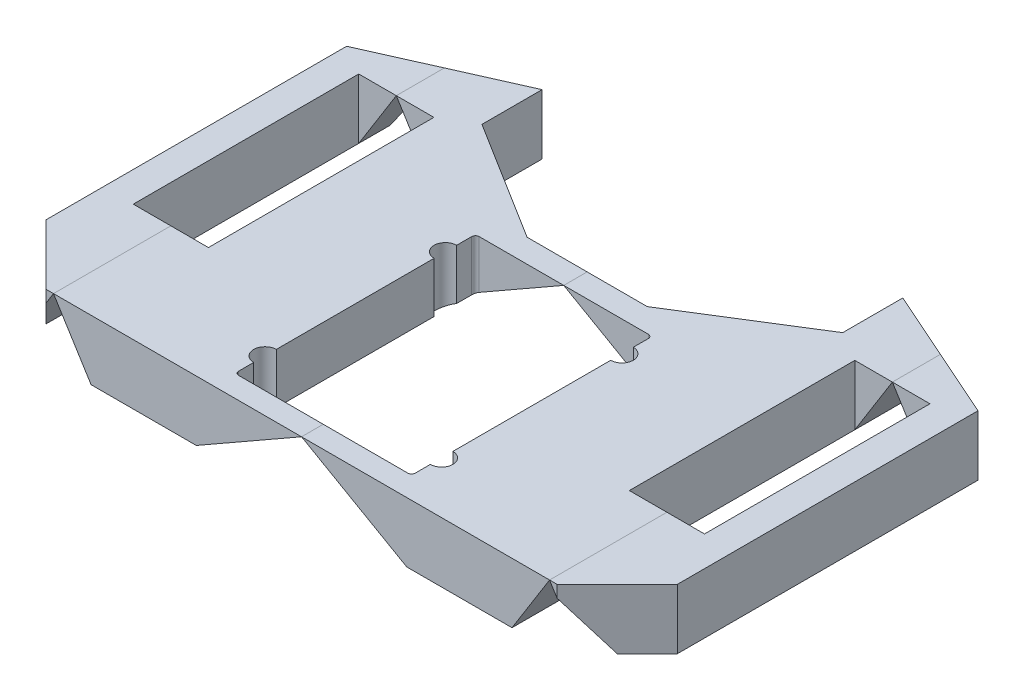
from build123d import *

# Parameters (mm, degrees)
SKETCH1_W           = 63.5
SKETCH1_H           = 190.5
BOSS_EXTRUDE1_DEPTH = 50.8
CUT_EXTRUDE1_DEPTH  = 708.805574494
CUT_EXTRUDE2_DEPTH  = 708.805574494


with BuildPart() as part:
    # Sketch1 → Boss-Extrude1 (new body)
    with BuildSketch(Plane(origin=(0, 0, 0), x_dir=(1, 0, 0), z_dir=(0, 1, 0))):
        Polygon((446.699903074, -123.787447361), (345.099903074, -187.287447361), (243.499903074, -187.287447361), (141.899903074, -123.787447361), (141.899903074, -72.987447361), (27.599903074, -123.787447361), (27.599903074, -123.848308515), (27.599903074, -375.907017994), (27.599903074, -377.787447361), (78.399903074, -428.587447361), (510.199903074, -428.587447361), (560.999903074, -377.787447361), (560.999903074, -123.787447361), (446.699903074, -72.987447361), align=None)
        with Locations((84.749903074, -234.21600548)):
            Rectangle(SKETCH1_W, SKETCH1_H, mode=Mode.SUBTRACT)
        with Locations((503.849903074, -234.21600548)):
            Rectangle(SKETCH1_W, SKETCH1_H, mode=Mode.SUBTRACT)
    extrude(amount=-BOSS_EXTRUDE1_DEPTH)

    # Sketch2 → Cut-Extrude1 (cut, through all)
    with BuildSketch(Plane.XY):
        Polygon((52.999903074, -50.8), (84.749903074, 0), (116.499903074, -50.8), align=None)
        Polygon((294.299903074, 0), (205.399903074, -50.8), (383.199903074, -50.8), align=None)
        Polygon((472.099903074, -50.8), (535.599903074, -50.8), (503.849903074, 0), align=None)
    extrude(amount=CUT_EXTRUDE1_DEPTH, mode=Mode.SUBTRACT)


with BuildPart() as cut_extrude1_piece_1:
    # of the separate pieces the step leaves, piece 1, a body of its own (cut_extrude1_pieces)
    add(part.part.solids().sort_by_distance((116.499903074, 0, 329.46600548))[0])


with BuildPart() as cut_extrude1_piece_2:
    # of the separate pieces the step leaves, piece 2, a body of its own (cut_extrude1_pieces)
    add(part.part.solids().sort_by_distance((446.699903074, 0, 123.787447361))[0])


with BuildPart() as cut_extrude1_piece_3:
    # of the separate pieces the step leaves, piece 3, a body of its own (cut_extrude1_pieces)
    add(part.part.solids().sort_by_distance((560.999903074, 0, 123.787447361))[0])


with BuildPart() as cut_extrude1_piece_4:
    # of the separate pieces the step leaves, piece 4, a body of its own (cut_extrude1_pieces)
    add(part.part.solids().sort_by_distance((78.399903074, 0, 428.587447361))[0])


with BuildPart() as cut_extrude2_tool:
    # Sketch4 → Cut-Extrude2 (new, through all)
    with BuildSketch(Plane(origin=(0, 0, 0), x_dir=(1, 0, 0), z_dir=(0, 1, 0))):
        with BuildLine():
            Line((368.912403074, -222.939372853), (368.912403074, -210.239372853))
            ThreePointArc((368.912403074, -210.239372853), (367.982467104, -207.994308822), (365.737403074, -207.064372853))
            Line((365.737403074, -207.064372853), (222.862403074, -207.064372853))
            ThreePointArc((222.862403074, -207.064372853), (220.617339043, -207.994308822), (219.687403074, -210.239372853))
            Line((219.687403074, -210.239372853), (219.687403074, -222.939372853))
            ThreePointArc((219.687403074, -222.939372853), (210.162403074, -232.464372853), (219.687403074, -241.989372853))
            Line((219.687403074, -241.989372853), (219.687403074, -375.339372853))
            ThreePointArc((219.687403074, -375.339372853), (210.162403074, -384.864372853), (219.687403074, -394.389372853))
            Line((219.687403074, -394.389372853), (219.687403074, -407.089372853))
            ThreePointArc((219.687403074, -407.089372853), (220.617339043, -409.334436883), (222.862403074, -410.264372853))
            Line((222.862403074, -410.264372853), (365.737403074, -410.264372853))
            ThreePointArc((365.737403074, -410.264372853), (367.982467104, -409.334436883), (368.912403074, -407.089372853))
            Line((368.912403074, -407.089372853), (368.912403074, -394.389372853))
            ThreePointArc((368.912403074, -394.389372853), (378.437403074, -384.864372853), (368.912403074, -375.339372853))
            Line((368.912403074, -375.339372853), (368.912403074, -241.989372853))
            ThreePointArc((368.912403074, -241.989372853), (378.437403074, -232.464372853), (368.912403074, -222.939372853))
        make_face()
    extrude(amount=-CUT_EXTRUDE2_DEPTH)


with BuildPart() as cut_extrude1_piece_1_1:
    add(cut_extrude1_piece_1.part)

    # Cut-Extrude2: cut by cut_extrude2_tool
    add(cut_extrude2_tool.part, mode=Mode.SUBTRACT)


with BuildPart() as cut_extrude1_piece_2_1:
    add(cut_extrude1_piece_2.part)

    # Cut-Extrude2: cut by cut_extrude2_tool
    add(cut_extrude2_tool.part, mode=Mode.SUBTRACT)


solid = Compound([cut_extrude1_piece_3.part, cut_extrude1_piece_4.part, cut_extrude1_piece_1_1.part, cut_extrude1_piece_2_1.part])
